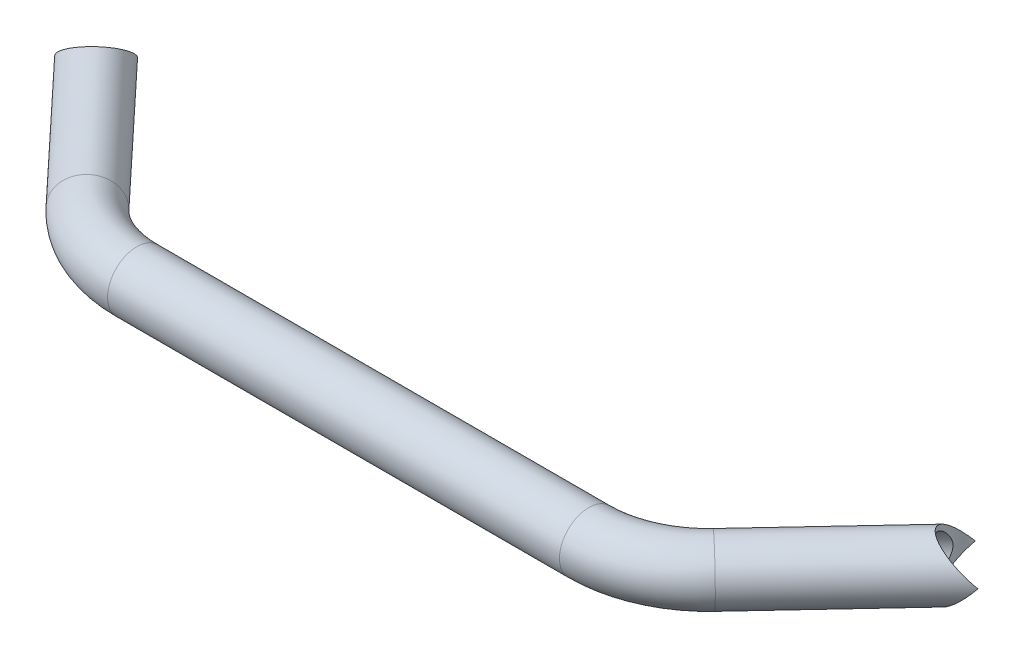
from build123d import *
from build123d.topology import SkipClean

# Parameters (mm, degrees)
SKETCH_4_R          = 12.5
SKETCH_4_R_2        = 10.5
CUT_EXTRUDE_START   = -12.5000001
CUT_EXTRUDE_1_DEPTH = 25.0000001


# Read off the part's stored shape, not the designer's step: Вырез-Вытянуть1
with BuildPart() as part:
    # По траектории2: sweep along a path in Эскиз1
    with BuildLine(Plane(origin=(0, 0, 0), x_dir=(1, 0, 0), z_dir=(0, 1, 0))) as sweep_2_path:
        Line((-186.966101695, 73.672565631), (-132.818565926, 15.829831696))
        ThreePointArc((-132.818565926, 15.829831696), (-116.209877383, 4.127849745), (-96.316517235, 5.78e-07))
        Line((-96.316517235, 5.78e-07), (96.316517396, 5.78e-07))
        ThreePointArc((96.316517396, 5.78e-07), (116.209877578, 4.12784976), (132.818566138, 15.829831751))
        Line((132.818566138, 15.829831751), (186.966101695, 73.672565631))
    # Эскиз4 → По траектории2 (sweep)
    with BuildSketch(Plane(origin=(186.966101695, 0, -73.672565631), x_dir=(0.7300409748240902, 0, 0.6834033765485009), z_dir=(-0.6834033765485009, 0, 0.7300409748240902))):
        with Locations((0.952301131, 0)):
            Circle(SKETCH_4_R)
        with Locations((0.952301131, 0)):
            Circle(SKETCH_4_R_2, mode=Mode.SUBTRACT)
    sweep(path=sweep_2_path.line)

    # Вырез-Вытянуть1 outline → Вырез-Вытянуть1 (cut)
    with SkipClean():  # the faces are left unmerged after this step: merging them gives an invalid solid
        with BuildSketch(Plane(origin=(0, 0, 0), x_dir=(1, 0, 0), z_dir=(0, 1, 0)).offset(CUT_EXTRUDE_START)):
            with BuildLine():
                Line((196.786832727, 64.479217615), (178.535808357, 81.564302028))
                ThreePointArc((178.535808357, 81.564302028), (179.118778335, 63.896247636), (196.786832727, 64.479217615))
            make_face()
            with BuildLine():
                Line((-178.535808367, 81.564302042), (-196.786832713, 64.479217601))
                ThreePointArc((-196.786832713, 64.479217601), (-179.11877832, 63.896247649), (-178.535808367, 81.564302042))
            make_face()
        extrude(amount=CUT_EXTRUDE_1_DEPTH, mode=Mode.SUBTRACT)


solid = part.part
